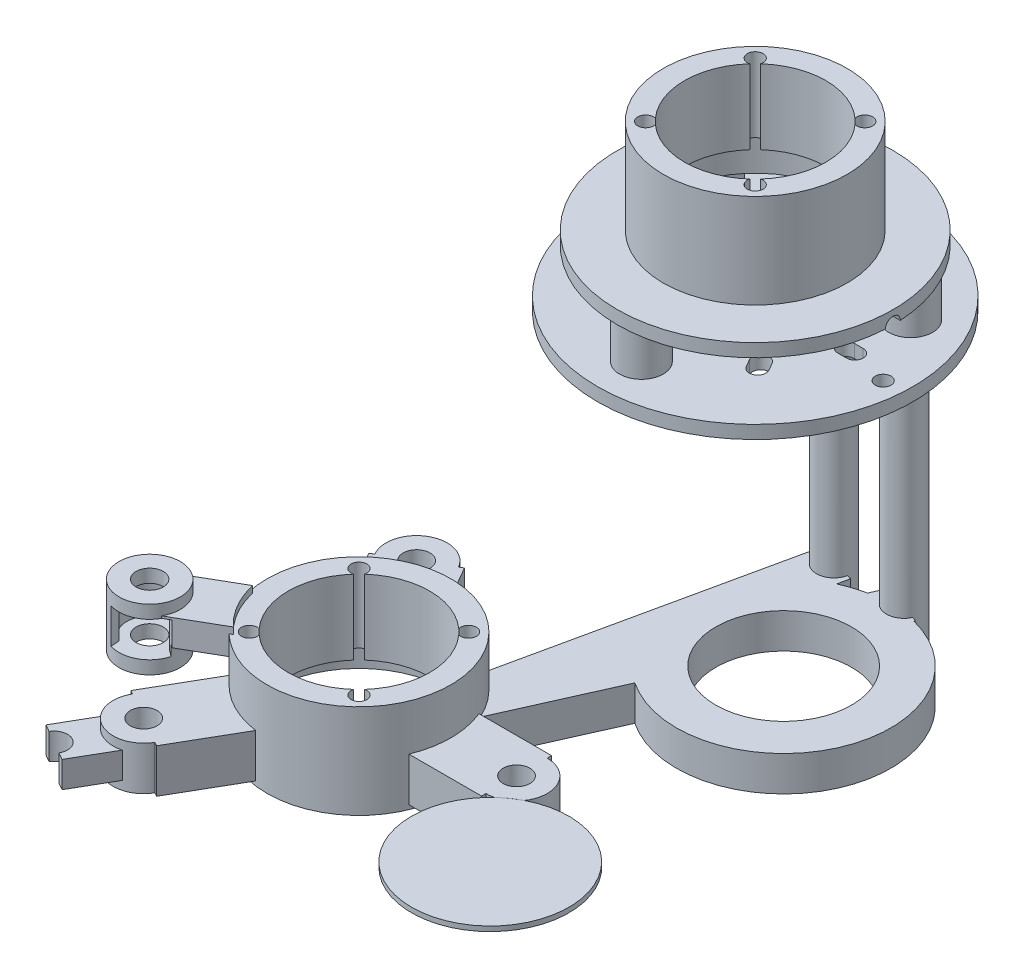
from build123d import *

# Parameters (mm, degrees)
CARRIER_INBOARD_FRAME_SKETCH_R              = 15.5
CARRIER_INBOARD_FRAME_SKETCH_R_2            = 3.050000001
CARRIER_INBOARD_FRAME_SKETCH_R_3            = 3.050000002
CARRIER_INBOARD_FRAME_SKETCH_R_4            = 3.049999999
CARRIER_INBOARD_FRAME_DEPTH                 = 4.5
CARRIER_START                               = 0.9
CARRIER_GUIDE_AND_PIVOT_FRAME_2_SKETCH_R    = 15.5
CARRIER_GUIDE_AND_PIVOT_FRAME_2_SKETCH_R_2  = 3.050000001
CARRIER_GUIDE_AND_PIVOT_FRAME_2_SKETCH_R_3  = 3.050000002
CARRIER_GUIDE_AND_PIVOT_FRAME_2_SKETCH_R_4  = 3.049999999
CARRIER_GUIDE_AND_PIVOT_FRAME_2_DEPTH       = 0.9
CARRIER_START_2                             = 0.1
CARRIER_GUIDE_AND_PIVOT_FRAME_3_SKETCH_R    = 15.5
CARRIER_GUIDE_AND_PIVOT_FRAME_3_SKETCH_R_2  = 3.050000001
CARRIER_GUIDE_AND_PIVOT_FRAME_3_SKETCH_R_3  = 3.050000002
CARRIER_GUIDE_AND_PIVOT_FRAME_3_SKETCH_R_4  = 3.049999999
CARRIER_GUIDE_AND_PIVOT_FRAME_3_DEPTH       = 0.1
CARRIER_START_3                             = 0.999999998
CARRIER_GUIDE_AND_PIVOT_FRAME_4_SKETCH_R    = 4
CARRIER_GUIDE_AND_PIVOT_FRAME_4_SKETCH_R_2  = 3.050000001
CARRIER_GUIDE_AND_PIVOT_FRAME_4_SKETCH_R_3  = 3.050000002
CARRIER_GUIDE_AND_PIVOT_FRAME_4_SKETCH_R_4  = 3.049999999
CARRIER_GUIDE_AND_PIVOT_FRAME_4_DEPTH       = 0.999999998
CARRIER_START_4                             = 0.010000002
CARRIER_GUIDE_AND_PIVOT_FRAME_5_SKETCH_R    = 4
CARRIER_GUIDE_AND_PIVOT_FRAME_5_SKETCH_R_2  = 21
CARRIER_GUIDE_AND_PIVOT_FRAME_5_SKETCH_R_3  = 18.000000001
CARRIER_GUIDE_AND_PIVOT_FRAME_5_DEPTH       = 0.010000002
CARRIER_START_5                             = 0.490000001
CARRIER_GUIDE_AND_PIVOT_FRAME_6_SKETCH_R    = 4
CARRIER_GUIDE_AND_PIVOT_FRAME_6_SKETCH_R_2  = 21
CARRIER_GUIDE_AND_PIVOT_FRAME_6_DEPTH       = 0.490000001
CARRIER_START_6                             = 2.999999998
CARRIER_GUIDE_AND_PIVOT_FRAME_7_SKETCH_R    = 4
CARRIER_GUIDE_AND_PIVOT_FRAME_7_SKETCH_R_2  = 21
CARRIER_GUIDE_AND_PIVOT_FRAME_7_SKETCH_R_3  = 3.1
CARRIER_GUIDE_AND_PIVOT_FRAME_7_DEPTH       = 2.999999998
CARRIER_GUIDE_AND_PIVOT_FRAME_8_SKETCH_R    = 4
CARRIER_GUIDE_AND_PIVOT_FRAME_8_SKETCH_R_2  = 21
CARRIER_GUIDE_AND_PIVOT_FRAME_8_DEPTH       = 2.500000001
CARRIER_GUIDE_AND_PIVOT_FRAME_9_SKETCH_R    = 4
CARRIER_GUIDE_AND_PIVOT_FRAME_9_DEPTH       = 4.5
CARRIER_GUIDE_AND_PIVOT_FRAME_10_SKETCH_R   = 4
CARRIER_GUIDE_AND_PIVOT_FRAME_10_DEPTH      = 1.000000001
CARRIER_GUIDE_AND_PIVOT_FRAME_11_SKETCH_R   = 4
CARRIER_GUIDE_AND_PIVOT_FRAME_11_SKETCH_R_2 = 3.1
CARRIER_GUIDE_AND_PIVOT_FRAME_11_DEPTH      = 0.5
CARRIER_GUIDE_AND_PIVOT_FRAME_12_SKETCH_R   = 4
CARRIER_GUIDE_AND_PIVOT_FRAME_12_SKETCH_R_2 = 3.1
CARRIER_GUIDE_AND_PIVOT_FRAME_12_DEPTH      = 2.499999999
CARRIER_WHEEL_SUPPORT_13_SKETCH_R           = 4
CARRIER_WHEEL_SUPPORT_13_DEPTH              = 43.5
CARRIER_WHEEL_SUPPORT_14_SKETCH_R           = 4
CARRIER_WHEEL_SUPPORT_14_DEPTH              = 2.2
CARRIER_WHEEL_SUPPORT_15_SKETCH_R           = 4
CARRIER_WHEEL_SUPPORT_15_DEPTH              = 2.9
CARRIER_WHEEL_SUPPORT_16_SKETCH_R           = 4
CARRIER_WHEEL_SUPPORT_16_DEPTH              = 2.9
CARRIER_WHEEL_SUPPORT_17_SKETCH_R           = 36
CARRIER_WHEEL_SUPPORT_17_SKETCH_R_2         = 1.8
CARRIER_WHEEL_SUPPORT_17_SKETCH_R_3         = 5
CARRIER_WHEEL_SUPPORT_17_DEPTH              = 3
CARRIER_WHEEL_SUPPORT_18_SKETCH_R           = 5
CARRIER_WHEEL_SUPPORT_18_SKETCH_R_2         = 4
CARRIER_WHEEL_SUPPORT_18_DEPTH              = 0.9
CARRIER_WHEEL_SUPPORT_19_SKETCH_R           = 5
CARRIER_WHEEL_SUPPORT_19_SKETCH_R_2         = 4
CARRIER_WHEEL_SUPPORT_19_DEPTH              = 1.5
CARRIER_WHEEL_SUPPORT_20_SKETCH_R           = 5
CARRIER_WHEEL_SUPPORT_20_SKETCH_R_2         = 4
CARRIER_WHEEL_SUPPORT_20_DEPTH              = 7.600000002
CARRIER_WHEEL_SUPPORT_21_SKETCH_R           = 31.5
CARRIER_WHEEL_SUPPORT_21_SKETCH_R_2         = 20.15
CARRIER_WHEEL_SUPPORT_21_DEPTH              = 2.999999998
CARRIER_WHEEL_SUPPORT_22_SKETCH_R           = 21
CARRIER_WHEEL_SUPPORT_22_SKETCH_R_2         = 20.15
CARRIER_WHEEL_SUPPORT_22_DEPTH              = 4.5
CARRIER_WHEEL_SUPPORT_23_SKETCH_R           = 21
CARRIER_WHEEL_SUPPORT_23_DEPTH              = 17
CARRIER_GUIDE_AND_PIVOT_FRAME_24_SKETCH_R   = 15.500000001
CARRIER_GUIDE_AND_PIVOT_FRAME_24_SKETCH_R_2 = 20.150000001
CARRIER_GUIDE_AND_PIVOT_FRAME_24_SKETCH_R_3 = 3.05
CARRIER_GUIDE_AND_PIVOT_FRAME_24_SKETCH_R_4 = 3.050000003
CARRIER_GUIDE_AND_PIVOT_FRAME_24_DEPTH      = 1.499999999
CARRIER_GUIDE_AND_PIVOT_FRAME_25_SKETCH_R   = 15.500000001
CARRIER_GUIDE_AND_PIVOT_FRAME_25_SKETCH_R_2 = 20.150000001
CARRIER_GUIDE_AND_PIVOT_FRAME_25_SKETCH_R_3 = 3.05
CARRIER_GUIDE_AND_PIVOT_FRAME_25_SKETCH_R_4 = 3.050000003
CARRIER_GUIDE_AND_PIVOT_FRAME_25_DEPTH      = 0.999999996
CARRIER_GUIDE_AND_PIVOT_FRAME_26_SKETCH_R   = 20.150000001
CARRIER_GUIDE_AND_PIVOT_FRAME_26_SKETCH_R_2 = 3.05
CARRIER_GUIDE_AND_PIVOT_FRAME_26_SKETCH_R_3 = 3.050000003
CARRIER_GUIDE_AND_PIVOT_FRAME_26_DEPTH      = 1.000000006
CARRIER_GUIDE_AND_PIVOT_FRAME_27_SKETCH_R   = 21
CARRIER_GUIDE_AND_PIVOT_FRAME_27_SKETCH_R_2 = 20.15
CARRIER_GUIDE_AND_PIVOT_FRAME_27_DEPTH      = 0.999999998
COUPLING_PIN_SERVICE_CHANNEL_SKETCH_R       = 1.7
COUPLING_PIN_SERVICE_CHANNEL_DEPTH          = 66


with BuildPart() as part:
    # Carrier Inboard Frame Sketch → Carrier Inboard Frame (new body)
    with BuildSketch(Plane(origin=(0, 132, 0), x_dir=(1, 0, 0), z_dir=(0, 1, 0))):
        with BuildLine():
            Line((-30.917751515, 80.095230605), (-31.894893673, 80.307817537))
            Line((-31.894893673, 80.307817537), (-45.453402184, 17.987005233))
            ThreePointArc((-45.453402184, 17.987005233), (-52.021603008, 20.561291011), (-59.071691938, 20.81517172))
            Line((-59.071691938, 20.81517172), (-67.363448018, 35.176914535))
            Line((-67.363448018, 35.176914535), (-68.229473421, 34.676914535))
            ThreePointArc((-68.229473421, 34.676914535), (-77.791651247, 37.239092362), (-80.353829074, 27.676914536))
            Line((-80.353829074, 27.676914536), (-81.219854478, 27.176914536))
            Line((-81.219854478, 27.176914536), (-72.928098397, 12.815171719))
            ThreePointArc((-72.928098397, 12.815171719), (-77.291651246, 0), (-72.928098397, -12.815171719))
            Line((-72.928098397, -12.815171719), (-81.219854478, -27.176914536))
            Line((-81.219854478, -27.176914536), (-80.353829072, -27.676914537))
            ThreePointArc((-80.353829072, -27.676914537), (-81.227012981, -30.227832035), (-81.071268007, -32.919555224))
            Line((-81.071268007, -32.919555224), (-86.121778264, -41.667295594))
            Line((-86.121778264, -41.667295594), (-84.476329997, -42.617295594))
            ThreePointArc((-84.476329997, -42.617295594), (-80.241651245, -41.482616842), (-79.106972494, -45.717295594))
            Line((-79.106972494, -45.717295594), (-77.461524226, -46.667295594))
            Line((-77.461524226, -46.667295594), (-72.411013969, -37.919555224))
            ThreePointArc((-72.411013969, -37.919555224), (-70.002040821, -36.708572734), (-68.229473419, -34.676914537))
            Line((-68.229473419, -34.676914537), (-67.363448017, -35.176914536))
            Line((-67.363448017, -35.176914536), (-59.071691937, -20.815171721))
            ThreePointArc((-59.071691937, -20.815171721), (-57.684740236, -20.953741982), (-56.291651246, -21))
            ThreePointArc((-56.291651246, -21), (-44.6083298, -17.449928367), (-36.875163407, -8))
            Line((-36.875163407, -8), (-20.291651246, -8))
            Line((-20.291651246, -8), (-20.291651246, -7))
            ThreePointArc((-20.291651246, -7), (-17.066350873, -6.212683599), (-14.566573894, -4.027839286))
            Line((-14.566573894, -4.027839286), (-14.552272959, -4.007435199))
            ThreePointArc((-14.552272959, -4.007435199), (-14.084717769, 3.236352392), (-20.291651247, 7))
            Line((-20.291651247, 7), (-20.291651247, 8))
            Line((-20.291651247, 8), (-36.875163407, 8))
            ThreePointArc((-36.875163407, 8), (-36.968781126, 8.223544876), (-37.06497245, 8.445994462))
            Line((-37.06497245, 8.445994462), (-26.171286763, 32.907800552))
            ThreePointArc((-26.171286763, 32.907800552), (9.87180094, 43.277859095), (-6.533321658, 77.004914078))
            Line((-6.533321658, 77.004914078), (-6.441635164, 77.210796392))
            Line((-6.441635164, 77.210796392), (-7.355144702, 77.617613686))
            ThreePointArc((-7.355144702, 77.617613686), (-7.1390628, 80.255907409), (-8.617920583, 82.451417558))
            ThreePointArc((-8.617920583, 82.451417558), (-12.020207409, 83.115002954), (-14.663221052, 80.872152065))
            Line((-14.663221052, 80.872152065), (-15.576730603, 81.278969365))
            Line((-15.576730603, 81.278969365), (-17.367224839, 77.258408824))
            ThreePointArc((-17.367224839, 77.258408824), (-20.084271186, 76.544411569), (-22.701719693, 75.524070327))
            Line((-22.701719693, 75.524070327), (-22.123472094, 78.181948221))
            Line((-22.123472094, 78.181948221), (-23.100614252, 78.394535152))
            ThreePointArc((-23.100614252, 78.394535152), (-23.840404568, 81.685957231), (-26.834136801, 83.241050902))
            ThreePointArc((-26.834136801, 83.241050902), (-29.450257235, 82.413661194), (-30.917751515, 80.095230605))
        make_face()
        with Locations((-12.509182883, 53.244882879)):
            Circle(CARRIER_INBOARD_FRAME_SKETCH_R, mode=Mode.SUBTRACT)
        with Locations((-20.291651247, 0)):
            Circle(CARRIER_INBOARD_FRAME_SKETCH_R_2, mode=Mode.SUBTRACT)
        with Locations((-74.291651248, 31.176914536)):
            Circle(CARRIER_INBOARD_FRAME_SKETCH_R_3, mode=Mode.SUBTRACT)
        with Locations((-74.291651245, -31.176914537)):
            Circle(CARRIER_INBOARD_FRAME_SKETCH_R_4, mode=Mode.SUBTRACT)
        with BuildLine():
            ThreePointArc((-67.076797269, -12.020945274), (-70.080233479, -13.788582233), (-68.31259652, -10.785146023))
            ThreePointArc((-68.31259652, -10.785146023), (-72.441651246, 0), (-68.31259652, 10.785146023))
            ThreePointArc((-68.31259652, 10.785146023), (-70.080233479, 13.788582233), (-67.076797269, 12.020945274))
            ThreePointArc((-67.076797269, 12.020945274), (-56.291651246, 16.15), (-45.506505223, 12.020945274))
            ThreePointArc((-45.506505223, 12.020945274), (-42.503069013, 13.788582233), (-44.270705972, 10.785146023))
            ThreePointArc((-44.270705972, 10.785146023), (-40.141651246, 0), (-44.270705972, -10.785146023))
            ThreePointArc((-44.270705972, -10.785146023), (-42.503069013, -13.788582233), (-45.506505223, -12.020945274))
            ThreePointArc((-45.506505223, -12.020945274), (-56.291651246, -16.15), (-67.076797269, -12.020945274))
        make_face(mode=Mode.SUBTRACT)
    extrude(amount=-CARRIER_INBOARD_FRAME_DEPTH)

    # Carrier Guide and Pivot Frame 2 Sketch → Carrier Guide and Pivot Frame 2 (add)
    with BuildSketch(Plane(origin=(0, 132, 0), x_dir=(1, 0, 0), z_dir=(0, 1, 0)).offset(CARRIER_START)):
        with BuildLine():
            Line((-30.917751515, 80.095230605), (-31.894893673, 80.307817537))
            Line((-31.894893673, 80.307817537), (-45.453402184, 17.987005233))
            ThreePointArc((-45.453402184, 17.987005233), (-52.021603008, 20.561291011), (-59.071691938, 20.81517172))
            Line((-59.071691938, 20.81517172), (-67.363448018, 35.176914535))
            Line((-67.363448018, 35.176914535), (-68.229473421, 34.676914536))
            ThreePointArc((-68.229473421, 34.676914536), (-77.791651247, 37.239092362), (-80.353829074, 27.676914536))
            Line((-80.353829074, 27.676914536), (-81.219854478, 27.176914536))
            Line((-81.219854478, 27.176914536), (-72.928098397, 12.815171719))
            ThreePointArc((-72.928098397, 12.815171719), (-77.291651246, 0), (-72.928098397, -12.815171719))
            Line((-72.928098397, -12.815171719), (-81.219854478, -27.176914536))
            Line((-81.219854478, -27.176914536), (-80.353829071, -27.676914537))
            ThreePointArc((-80.353829071, -27.676914537), (-79.823309442, -35.466524962), (-72.411013969, -37.919555224))
            ThreePointArc((-72.411013969, -37.919555224), (-70.002040821, -36.708572734), (-68.229473419, -34.676914537))
            Line((-68.229473419, -34.676914537), (-67.363448017, -35.176914536))
            Line((-67.363448017, -35.176914536), (-59.071691937, -20.815171721))
            ThreePointArc((-59.071691937, -20.815171721), (-57.684740236, -20.953741982), (-56.291651246, -21))
            ThreePointArc((-56.291651246, -21), (-44.6083298, -17.449928367), (-36.875163407, -8))
            Line((-36.875163407, -8), (-20.291651246, -8))
            Line((-20.291651246, -8), (-20.291651246, -7))
            ThreePointArc((-20.291651246, -7), (-17.066350873, -6.212683599), (-14.566573895, -4.027839286))
            Line((-14.566573895, -4.027839286), (-14.55227296, -4.007435199))
            ThreePointArc((-14.55227296, -4.007435199), (-14.084717769, 3.236352392), (-20.291651247, 7))
            Line((-20.291651247, 7), (-20.291651247, 8))
            Line((-20.291651247, 8), (-36.875163407, 8))
            ThreePointArc((-36.875163407, 8), (-36.968781126, 8.223544876), (-37.06497245, 8.445994462))
            Line((-37.06497245, 8.445994462), (-26.171286763, 32.907800552))
            ThreePointArc((-26.171286763, 32.907800552), (9.87180094, 43.277859095), (-6.533321658, 77.004914078))
            Line((-6.533321658, 77.004914078), (-6.441635164, 77.210796392))
            Line((-6.441635164, 77.210796392), (-7.355144702, 77.617613686))
            ThreePointArc((-7.355144702, 77.617613686), (-7.1390628, 80.255907409), (-8.617920583, 82.451417558))
            ThreePointArc((-8.617920583, 82.451417558), (-12.02020741, 83.115002954), (-14.663221052, 80.872152065))
            Line((-14.663221052, 80.872152065), (-15.576730603, 81.278969365))
            Line((-15.576730603, 81.278969365), (-17.367224839, 77.258408824))
            ThreePointArc((-17.367224839, 77.258408824), (-20.084271187, 76.544411569), (-22.701719693, 75.524070327))
            Line((-22.701719693, 75.524070327), (-22.123472094, 78.181948221))
            Line((-22.123472094, 78.181948221), (-23.100614252, 78.394535152))
            ThreePointArc((-23.100614252, 78.394535152), (-23.840404569, 81.685957231), (-26.834136802, 83.241050902))
            ThreePointArc((-26.834136802, 83.241050902), (-29.450257235, 82.413661194), (-30.917751515, 80.095230605))
        make_face()
        with Locations((-12.509182883, 53.244882879)):
            Circle(CARRIER_GUIDE_AND_PIVOT_FRAME_2_SKETCH_R, mode=Mode.SUBTRACT)
        with Locations((-20.291651247, 0)):
            Circle(CARRIER_GUIDE_AND_PIVOT_FRAME_2_SKETCH_R_2, mode=Mode.SUBTRACT)
        with Locations((-74.291651248, 31.176914536)):
            Circle(CARRIER_GUIDE_AND_PIVOT_FRAME_2_SKETCH_R_3, mode=Mode.SUBTRACT)
        with Locations((-74.291651245, -31.176914537)):
            Circle(CARRIER_GUIDE_AND_PIVOT_FRAME_2_SKETCH_R_4, mode=Mode.SUBTRACT)
        with BuildLine():
            ThreePointArc((-67.076797269, -12.020945274), (-70.080233479, -13.788582233), (-68.31259652, -10.785146023))
            ThreePointArc((-68.31259652, -10.785146023), (-72.441651246, 0), (-68.31259652, 10.785146023))
            ThreePointArc((-68.31259652, 10.785146023), (-70.080233479, 13.788582233), (-67.076797269, 12.020945274))
            ThreePointArc((-67.076797269, 12.020945274), (-56.291651246, 16.15), (-45.506505223, 12.020945274))
            ThreePointArc((-45.506505223, 12.020945274), (-42.503069013, 13.788582233), (-44.270705972, 10.785146023))
            ThreePointArc((-44.270705972, 10.785146023), (-40.141651246, 0), (-44.270705972, -10.785146023))
            ThreePointArc((-44.270705972, -10.785146023), (-42.503069013, -13.788582233), (-45.506505223, -12.020945274))
            ThreePointArc((-45.506505223, -12.020945274), (-56.291651246, -16.15), (-67.076797269, -12.020945274))
        make_face(mode=Mode.SUBTRACT)
    extrude(amount=-CARRIER_GUIDE_AND_PIVOT_FRAME_2_DEPTH)

    # Carrier Guide and Pivot Frame 3 Sketch → Carrier Guide and Pivot Frame 3 (add)
    with BuildSketch(Plane(origin=(0, 132.900000001, 0), x_dir=(1, 0, 0), z_dir=(0, 1, 0)).offset(CARRIER_START_2)):
        with BuildLine():
            Line((-30.917751515, 80.095230605), (-31.894893673, 80.307817537))
            Line((-31.894893673, 80.307817537), (-45.453402184, 17.987005233))
            ThreePointArc((-45.453402184, 17.987005233), (-52.021603008, 20.561291011), (-59.071691938, 20.81517172))
            Line((-59.071691938, 20.81517172), (-67.363448018, 35.176914535))
            Line((-67.363448018, 35.176914535), (-68.229473421, 34.676914536))
            ThreePointArc((-68.229473421, 34.676914536), (-77.791651247, 37.239092362), (-80.353829074, 27.676914536))
            Line((-80.353829074, 27.676914536), (-81.219854478, 27.176914536))
            Line((-81.219854478, 27.176914536), (-72.928098397, 12.815171719))
            ThreePointArc((-72.928098397, 12.815171719), (-77.291651246, 0), (-72.928098397, -12.815171719))
            Line((-72.928098397, -12.815171719), (-81.219854478, -27.176914536))
            Line((-81.219854478, -27.176914536), (-80.353829071, -27.676914537))
            ThreePointArc((-80.353829071, -27.676914537), (-79.823309442, -35.466524962), (-72.411013969, -37.919555224))
            ThreePointArc((-72.411013969, -37.919555224), (-70.002040821, -36.708572734), (-68.229473419, -34.676914537))
            Line((-68.229473419, -34.676914537), (-67.363448017, -35.176914536))
            Line((-67.363448017, -35.176914536), (-59.071691937, -20.815171721))
            ThreePointArc((-59.071691937, -20.815171721), (-57.684740236, -20.953741982), (-56.291651246, -21))
            ThreePointArc((-56.291651246, -21), (-44.6083298, -17.449928367), (-36.875163407, -8))
            Line((-36.875163407, -8), (-20.291651246, -8))
            Line((-20.291651246, -8), (-20.291651246, -7))
            ThreePointArc((-20.291651246, -7), (-19.383531808, -6.940844263), (-18.490761077, -6.764376882))
            ThreePointArc((-18.490761077, -6.764376882), (4.030670954, -34.74617457), (-14.55227296, -4.007435199))
            ThreePointArc((-14.55227296, -4.007435199), (-14.084717769, 3.236352392), (-20.291651247, 7))
            Line((-20.291651247, 7), (-20.291651247, 8))
            Line((-20.291651247, 8), (-36.875163407, 8))
            ThreePointArc((-36.875163407, 8), (-36.968781126, 8.223544876), (-37.06497245, 8.445994462))
            Line((-37.06497245, 8.445994462), (-26.171286763, 32.907800552))
            ThreePointArc((-26.171286763, 32.907800552), (9.87180094, 43.277859095), (-6.533321658, 77.004914078))
            Line((-6.533321658, 77.004914078), (-6.441635164, 77.210796392))
            Line((-6.441635164, 77.210796392), (-7.355144702, 77.617613686))
            ThreePointArc((-7.355144702, 77.617613686), (-7.1390628, 80.255907409), (-8.617920583, 82.451417558))
            ThreePointArc((-8.617920583, 82.451417558), (-12.02020741, 83.115002954), (-14.663221053, 80.872152065))
            Line((-14.663221053, 80.872152065), (-15.576730603, 81.278969365))
            Line((-15.576730603, 81.278969365), (-17.367224839, 77.258408824))
            ThreePointArc((-17.367224839, 77.258408824), (-20.084271187, 76.544411569), (-22.701719693, 75.524070327))
            Line((-22.701719693, 75.524070327), (-22.123472094, 78.181948221))
            Line((-22.123472094, 78.181948221), (-23.100614253, 78.394535153))
            ThreePointArc((-23.100614253, 78.394535153), (-23.840404569, 81.685957231), (-26.834136802, 83.241050902))
            ThreePointArc((-26.834136802, 83.241050902), (-29.450257235, 82.413661194), (-30.917751515, 80.095230605))
        make_face()
        with Locations((-12.509182883, 53.244882879)):
            Circle(CARRIER_GUIDE_AND_PIVOT_FRAME_3_SKETCH_R, mode=Mode.SUBTRACT)
        with Locations((-20.291651247, 0)):
            Circle(CARRIER_GUIDE_AND_PIVOT_FRAME_3_SKETCH_R_2, mode=Mode.SUBTRACT)
        with Locations((-74.291651248, 31.176914536)):
            Circle(CARRIER_GUIDE_AND_PIVOT_FRAME_3_SKETCH_R_3, mode=Mode.SUBTRACT)
        with Locations((-74.291651245, -31.176914537)):
            Circle(CARRIER_GUIDE_AND_PIVOT_FRAME_3_SKETCH_R_4, mode=Mode.SUBTRACT)
        with BuildLine():
            ThreePointArc((-67.076797269, -12.020945274), (-70.080233479, -13.788582233), (-68.31259652, -10.785146023))
            ThreePointArc((-68.31259652, -10.785146023), (-72.441651246, 0), (-68.31259652, 10.785146023))
            ThreePointArc((-68.31259652, 10.785146023), (-70.080233479, 13.788582233), (-67.076797269, 12.020945274))
            ThreePointArc((-67.076797269, 12.020945274), (-56.291651246, 16.15), (-45.506505223, 12.020945274))
            ThreePointArc((-45.506505223, 12.020945274), (-42.503069013, 13.788582233), (-44.270705972, 10.785146023))
            ThreePointArc((-44.270705972, 10.785146023), (-40.141651246, 0), (-44.270705972, -10.785146023))
            ThreePointArc((-44.270705972, -10.785146023), (-42.503069013, -13.788582233), (-45.506505223, -12.020945274))
            ThreePointArc((-45.506505223, -12.020945274), (-56.291651246, -16.15), (-67.076797269, -12.020945274))
        make_face(mode=Mode.SUBTRACT)
    extrude(amount=-CARRIER_GUIDE_AND_PIVOT_FRAME_3_DEPTH)

    # Carrier Guide and Pivot Frame 4 Sketch → Carrier Guide and Pivot Frame 4 (add)
    # profile 1 of 3: a face of its own
    with BuildSketch(Plane(origin=(0, 133, 0), x_dir=(1, 0, 0), z_dir=(0, 1, 0)).offset(CARRIER_START_3)):
        with Locations((-27.009182884, 79.244882879)):
            Circle(CARRIER_GUIDE_AND_PIVOT_FRAME_4_SKETCH_R)
    # profile 2 of 3: a face of its own
    with BuildSketch(Plane(origin=(0, 133, 0), x_dir=(1, 0, 0), z_dir=(0, 1, 0)).offset(CARRIER_START_3)):
        with Locations((-11.009182876, 79.244882879)):
            Circle(CARRIER_GUIDE_AND_PIVOT_FRAME_4_SKETCH_R)
    # profile 3 of 3: a face of its own
    with BuildSketch(Plane(origin=(0, 133, 0), x_dir=(1, 0, 0), z_dir=(0, 1, 0)).offset(CARRIER_START_3)):
        with BuildLine():
            Line((-67.363448017, -35.176914536), (-59.071691937, -20.815171721))
            ThreePointArc((-59.071691937, -20.815171721), (-57.684740236, -20.953741982), (-56.291651246, -21))
            ThreePointArc((-56.291651246, -21), (-44.6083298, -17.449928367), (-36.875163407, -8))
            Line((-36.875163407, -8), (-20.291651246, -8))
            Line((-20.291651246, -8), (-20.291651246, -7))
            ThreePointArc((-20.291651246, -7), (-19.383531808, -6.940844263), (-18.490761077, -6.764376882))
            ThreePointArc((-18.490761077, -6.764376882), (4.030670954, -34.74617457), (-14.55227296, -4.007435199))
            ThreePointArc((-14.55227296, -4.007435199), (-14.084717769, 3.236352392), (-20.291651247, 7))
            Line((-20.291651247, 7), (-20.291651247, 8))
            Line((-20.291651247, 8), (-36.875163407, 8))
            ThreePointArc((-36.875163407, 8), (-45.791651247, 18.18653348), (-59.071691938, 20.81517172))
            Line((-59.071691938, 20.81517172), (-67.363448018, 35.176914535))
            Line((-67.363448018, 35.176914535), (-68.229473421, 34.676914536))
            ThreePointArc((-68.229473421, 34.676914536), (-77.791651247, 37.239092362), (-80.353829074, 27.676914536))
            Line((-80.353829074, 27.676914536), (-81.219854478, 27.176914536))
            Line((-81.219854478, 27.176914536), (-72.928098397, 12.815171719))
            ThreePointArc((-72.928098397, 12.815171719), (-77.291651246, 0), (-72.928098397, -12.815171719))
            Line((-72.928098397, -12.815171719), (-81.219854478, -27.176914536))
            Line((-81.219854478, -27.176914536), (-80.353829071, -27.676914537))
            ThreePointArc((-80.353829071, -27.676914537), (-79.823309442, -35.466524962), (-72.411013969, -37.919555224))
            ThreePointArc((-72.411013969, -37.919555224), (-70.002040821, -36.708572734), (-68.229473419, -34.676914537))
            Line((-68.229473419, -34.676914537), (-67.363448017, -35.176914536))
        make_face()
        with Locations((-20.291651247, 0)):
            Circle(CARRIER_GUIDE_AND_PIVOT_FRAME_4_SKETCH_R_2, mode=Mode.SUBTRACT)
        with Locations((-74.291651248, 31.176914536)):
            Circle(CARRIER_GUIDE_AND_PIVOT_FRAME_4_SKETCH_R_3, mode=Mode.SUBTRACT)
        with Locations((-74.291651245, -31.176914537)):
            Circle(CARRIER_GUIDE_AND_PIVOT_FRAME_4_SKETCH_R_4, mode=Mode.SUBTRACT)
        with BuildLine():
            ThreePointArc((-67.076797269, -12.020945274), (-70.080233479, -13.788582233), (-68.31259652, -10.785146023))
            ThreePointArc((-68.31259652, -10.785146023), (-72.441651246, 0), (-68.31259652, 10.785146023))
            ThreePointArc((-68.31259652, 10.785146023), (-70.080233479, 13.788582233), (-67.076797269, 12.020945274))
            ThreePointArc((-67.076797269, 12.020945274), (-56.291651246, 16.15), (-45.506505223, 12.020945274))
            ThreePointArc((-45.506505223, 12.020945274), (-42.503069013, 13.788582233), (-44.270705972, 10.785146023))
            ThreePointArc((-44.270705972, 10.785146023), (-40.141651246, 0), (-44.270705972, -10.785146023))
            ThreePointArc((-44.270705972, -10.785146023), (-42.503069013, -13.788582233), (-45.506505223, -12.020945274))
            ThreePointArc((-45.506505223, -12.020945274), (-56.291651246, -16.15), (-67.076797269, -12.020945274))
        make_face(mode=Mode.SUBTRACT)
    extrude(amount=-CARRIER_GUIDE_AND_PIVOT_FRAME_4_DEPTH)

    # Carrier Guide and Pivot Frame 5 Sketch → Carrier Guide and Pivot Frame 5 (add)
    # profile 1 of 4: a face of its own
    with BuildSketch(Plane(origin=(0, 133.999999999, 0), x_dir=(1, 0, 0), z_dir=(0, 1, 0)).offset(CARRIER_START_4)):
        with Locations((-27.009182884, 79.244882879)):
            Circle(CARRIER_GUIDE_AND_PIVOT_FRAME_5_SKETCH_R)
    # profile 2 of 4: a face of its own
    with BuildSketch(Plane(origin=(0, 133.999999999, 0), x_dir=(1, 0, 0), z_dir=(0, 1, 0)).offset(CARRIER_START_4)):
        with Locations((-11.009182876, 79.244882879)):
            Circle(CARRIER_GUIDE_AND_PIVOT_FRAME_5_SKETCH_R)
    # profile 3 of 4: a face of its own
    with BuildSketch(Plane(origin=(0, 133.999999999, 0), x_dir=(1, 0, 0), z_dir=(0, 1, 0)).offset(CARRIER_START_4)):
        with Locations((-56.291651246, 0)):
            Circle(CARRIER_GUIDE_AND_PIVOT_FRAME_5_SKETCH_R_2)
        with BuildLine():
            ThreePointArc((-67.076797269, -12.020945274), (-70.080233479, -13.788582233), (-68.31259652, -10.785146023))
            ThreePointArc((-68.31259652, -10.785146023), (-72.441651246, 0), (-68.31259652, 10.785146023))
            ThreePointArc((-68.31259652, 10.785146023), (-70.080233479, 13.788582233), (-67.076797269, 12.020945274))
            ThreePointArc((-67.076797269, 12.020945274), (-56.291651246, 16.15), (-45.506505223, 12.020945274))
            ThreePointArc((-45.506505223, 12.020945274), (-42.503069013, 13.788582233), (-44.270705972, 10.785146023))
            ThreePointArc((-44.270705972, 10.785146023), (-40.141651246, 0), (-44.270705972, -10.785146023))
            ThreePointArc((-44.270705972, -10.785146023), (-42.503069013, -13.788582233), (-45.506505223, -12.020945274))
            ThreePointArc((-45.506505223, -12.020945274), (-56.291651246, -16.15), (-67.076797269, -12.020945274))
        make_face(mode=Mode.SUBTRACT)
    # profile 4 of 4: a face of its own
    with BuildSketch(Plane(origin=(0, 133.999999999, 0), x_dir=(1, 0, 0), z_dir=(0, 1, 0)).offset(CARRIER_START_4)):
        with Locations((-6.291651246, -20)):
            Circle(CARRIER_GUIDE_AND_PIVOT_FRAME_5_SKETCH_R_3)
    extrude(amount=-CARRIER_GUIDE_AND_PIVOT_FRAME_5_DEPTH)

    # Carrier Guide and Pivot Frame 6 Sketch → Carrier Guide and Pivot Frame 6 (add)
    # profile 1 of 3: a face of its own
    with BuildSketch(Plane(origin=(0, 134.010000001, 0), x_dir=(1, 0, 0), z_dir=(0, 1, 0)).offset(CARRIER_START_5)):
        with Locations((-27.009182884, 79.244882879)):
            Circle(CARRIER_GUIDE_AND_PIVOT_FRAME_6_SKETCH_R)
    # profile 2 of 3: a face of its own
    with BuildSketch(Plane(origin=(0, 134.010000001, 0), x_dir=(1, 0, 0), z_dir=(0, 1, 0)).offset(CARRIER_START_5)):
        with Locations((-11.009182876, 79.244882879)):
            Circle(CARRIER_GUIDE_AND_PIVOT_FRAME_6_SKETCH_R)
    # profile 3 of 3: a face of its own
    with BuildSketch(Plane(origin=(0, 134.010000001, 0), x_dir=(1, 0, 0), z_dir=(0, 1, 0)).offset(CARRIER_START_5)):
        with Locations((-56.291651246, 0)):
            Circle(CARRIER_GUIDE_AND_PIVOT_FRAME_6_SKETCH_R_2)
        with BuildLine():
            ThreePointArc((-67.076797269, -12.020945274), (-70.080233479, -13.788582233), (-68.31259652, -10.785146023))
            ThreePointArc((-68.31259652, -10.785146023), (-72.441651246, 0), (-68.31259652, 10.785146023))
            ThreePointArc((-68.31259652, 10.785146023), (-70.080233479, 13.788582233), (-67.076797269, 12.020945274))
            ThreePointArc((-67.076797269, 12.020945274), (-56.291651246, 16.15), (-45.506505223, 12.020945274))
            ThreePointArc((-45.506505223, 12.020945274), (-42.503069013, 13.788582233), (-44.270705972, 10.785146023))
            ThreePointArc((-44.270705972, 10.785146023), (-40.141651246, 0), (-44.270705972, -10.785146023))
            ThreePointArc((-44.270705972, -10.785146023), (-42.503069013, -13.788582233), (-45.506505223, -12.020945274))
            ThreePointArc((-45.506505223, -12.020945274), (-56.291651246, -16.15), (-67.076797269, -12.020945274))
        make_face(mode=Mode.SUBTRACT)
    extrude(amount=-CARRIER_GUIDE_AND_PIVOT_FRAME_6_DEPTH)

    # Carrier Guide and Pivot Frame 7 Sketch → Carrier Guide and Pivot Frame 7 (add)
    # profile 1 of 4: a face of its own
    with BuildSketch(Plane(origin=(0, 134.500000002, 0), x_dir=(1, 0, 0), z_dir=(0, 1, 0)).offset(CARRIER_START_6)):
        with Locations((-27.009182884, 79.244882879)):
            Circle(CARRIER_GUIDE_AND_PIVOT_FRAME_7_SKETCH_R)
    # profile 2 of 4: a face of its own
    with BuildSketch(Plane(origin=(0, 134.500000002, 0), x_dir=(1, 0, 0), z_dir=(0, 1, 0)).offset(CARRIER_START_6)):
        with Locations((-11.009182876, 79.244882879)):
            Circle(CARRIER_GUIDE_AND_PIVOT_FRAME_7_SKETCH_R)
    # profile 3 of 4: a face of its own
    with BuildSketch(Plane(origin=(0, 134.500000002, 0), x_dir=(1, 0, 0), z_dir=(0, 1, 0)).offset(CARRIER_START_6)):
        with Locations((-56.291651246, 0)):
            Circle(CARRIER_GUIDE_AND_PIVOT_FRAME_7_SKETCH_R_2)
        with BuildLine():
            ThreePointArc((-67.076797269, -12.020945274), (-70.080233479, -13.788582233), (-68.31259652, -10.785146023))
            ThreePointArc((-68.31259652, -10.785146023), (-72.441651246, 0), (-68.31259652, 10.785146023))
            ThreePointArc((-68.31259652, 10.785146023), (-70.080233479, 13.788582233), (-67.076797269, 12.020945274))
            ThreePointArc((-67.076797269, 12.020945274), (-56.291651246, 16.15), (-45.506505223, 12.020945274))
            ThreePointArc((-45.506505223, 12.020945274), (-42.503069013, 13.788582233), (-44.270705972, 10.785146023))
            ThreePointArc((-44.270705972, 10.785146023), (-40.141651246, 0), (-44.270705972, -10.785146023))
            ThreePointArc((-44.270705972, -10.785146023), (-42.503069013, -13.788582233), (-45.506505223, -12.020945274))
            ThreePointArc((-45.506505223, -12.020945274), (-56.291651246, -16.15), (-67.076797269, -12.020945274))
        make_face(mode=Mode.SUBTRACT)
    # profile 4 of 4: a face of its own
    with BuildSketch(Plane(origin=(0, 134.500000002, 0), x_dir=(1, 0, 0), z_dir=(0, 1, 0)).offset(CARRIER_START_6)):
        with BuildLine():
            ThreePointArc((-80.480041275, -20.893376598), (-92.534816728, -13.784075176), (-80.877463026, -21.527839286))
            ThreePointArc((-80.877463026, -21.527839286), (-80.670264028, -21.215924826), (-80.480041275, -20.893376598))
        make_face()
        with Locations((-86.602540378, -17.500000001)):
            Circle(CARRIER_GUIDE_AND_PIVOT_FRAME_7_SKETCH_R_3, mode=Mode.SUBTRACT)
    extrude(amount=-CARRIER_GUIDE_AND_PIVOT_FRAME_7_DEPTH)


with BuildPart() as carrier_guide_and_pivot_frame_7_piece_1:
    # of the separate pieces the step leaves, piece 1, a body of its own (carrier_guide_and_pivot_frame_7_pieces)
    add(part.part.solids().sort_by_distance((-7.355144702, 132, -77.617613686))[0])

    # Carrier Guide and Pivot Frame 8 Sketch → Carrier Guide and Pivot Frame 8 (add)
    # profile 1 of 4: a face of its own
    with BuildSketch(Plane(origin=(0, 137.5, 0), x_dir=(1, 0, 0), z_dir=(0, 1, 0))):
        with Locations((-27.009182884, 79.244882879)):
            Circle(CARRIER_GUIDE_AND_PIVOT_FRAME_8_SKETCH_R)
    # profile 2 of 4: a face of its own
    with BuildSketch(Plane(origin=(0, 137.5, 0), x_dir=(1, 0, 0), z_dir=(0, 1, 0))):
        with Locations((-11.009182876, 79.244882879)):
            Circle(CARRIER_GUIDE_AND_PIVOT_FRAME_8_SKETCH_R)
    # profile 3 of 4: a face of its own
    with BuildSketch(Plane(origin=(0, 137.5, 0), x_dir=(1, 0, 0), z_dir=(0, 1, 0))):
        with Locations((-56.291651246, 0)):
            Circle(CARRIER_GUIDE_AND_PIVOT_FRAME_8_SKETCH_R_2)
        with BuildLine():
            ThreePointArc((-67.076797269, -12.020945274), (-70.080233479, -13.788582233), (-68.31259652, -10.785146023))
            ThreePointArc((-68.31259652, -10.785146023), (-72.441651246, 0), (-68.31259652, 10.785146023))
            ThreePointArc((-68.31259652, 10.785146023), (-70.080233479, 13.788582233), (-67.076797269, 12.020945274))
            ThreePointArc((-67.076797269, 12.020945274), (-56.291651246, 16.15), (-45.506505223, 12.020945274))
            ThreePointArc((-45.506505223, 12.020945274), (-42.503069013, 13.788582233), (-44.270705972, 10.785146023))
            ThreePointArc((-44.270705972, 10.785146023), (-40.141651246, 0), (-44.270705972, -10.785146023))
            ThreePointArc((-44.270705972, -10.785146023), (-42.503069013, -13.788582233), (-45.506505223, -12.020945274))
            ThreePointArc((-45.506505223, -12.020945274), (-56.291651246, -16.15), (-67.076797269, -12.020945274))
        make_face(mode=Mode.SUBTRACT)
    # profile 4 of 4: a face of its own
    with BuildSketch(Plane(origin=(0, 137.5, 0), x_dir=(1, 0, 0), z_dir=(0, 1, 0))):
        with BuildLine():
            Line((-81.398299852, -18.191650588), (-79.855563295, -19.365020168))
            ThreePointArc((-79.855563295, -19.365020168), (-89.936771721, -11.34509128), (-88.725821636, -24.170208145))
            Line((-88.725821636, -24.170208145), (-88.86596326, -22.237026162))
            ThreePointArc((-88.86596326, -22.237026162), (-89.103213886, -12.88381846), (-81.398299852, -18.191650588))
        make_face()
    extrude(amount=CARRIER_GUIDE_AND_PIVOT_FRAME_8_DEPTH)


with BuildPart() as carrier_guide_and_pivot_frame_7_piece_2:
    # of the separate pieces the step leaves, piece 2, a body of its own (carrier_guide_and_pivot_frame_7_pieces)
    add(part.part.solids().sort_by_distance((-80.877463026, 137.5, 21.527839286))[0])


with BuildPart() as carrier_guide_and_pivot_frame_8_piece_1:
    # of the separate pieces the step leaves, piece 1, a body of its own (carrier_guide_and_pivot_frame_8_pieces)
    add(carrier_guide_and_pivot_frame_7_piece_1.part.solids().sort_by_distance((-7.355144702, 132, -77.617613686))[0])

    # Carrier Guide and Pivot Frame 9 Sketch → Carrier Guide and Pivot Frame 9 (add)
    # profile 1 of 3: a face of its own
    with BuildSketch(Plane(origin=(0, 140, 0), x_dir=(1, 0, 0), z_dir=(0, 1, 0))):
        with Locations((-27.009182885, 79.244882879)):
            Circle(CARRIER_GUIDE_AND_PIVOT_FRAME_9_SKETCH_R)
    # profile 2 of 3: a face of its own
    with BuildSketch(Plane(origin=(0, 140, 0), x_dir=(1, 0, 0), z_dir=(0, 1, 0))):
        with Locations((-11.009182877, 79.244882879)):
            Circle(CARRIER_GUIDE_AND_PIVOT_FRAME_9_SKETCH_R)
    # profile 3 of 3: a face of its own
    with BuildSketch(Plane(origin=(0, 140, 0), x_dir=(1, 0, 0), z_dir=(0, 1, 0))):
        with BuildLine():
            Line((-78.982709995, -20.028892107), (-70.720076304, -15.258458321))
            ThreePointArc((-70.720076304, -15.258458321), (-64.056069295, -19.511888999), (-56.291651249, -20.999999997))
            ThreePointArc((-56.291651249, -20.999999997), (-43.276068719, 16.480127776), (-76.720076308, -4.866153466))
            Line((-76.720076308, -4.866153466), (-86.480041404, -10.501071941))
            ThreePointArc((-86.480041404, -10.501071941), (-93.509935226, -16.365144764), (-88.725821637, -24.170208145))
            Line((-88.725821637, -24.170208145), (-88.86596326, -22.237026162))
            ThreePointArc((-88.86596326, -22.237026162), (-89.103213886, -12.883818462), (-81.398299852, -18.191650588))
            Line((-81.398299852, -18.191650588), (-78.982709995, -20.028892107))
        make_face()
        with BuildLine():
            ThreePointArc((-67.076797271, -12.020945271), (-70.080233482, -13.78858223), (-68.312596522, -10.78514602))
            ThreePointArc((-68.312596522, -10.78514602), (-72.441651249, 3e-09), (-68.312596522, 10.785146025))
            ThreePointArc((-68.312596522, 10.785146025), (-70.080233482, 13.788582236), (-67.076797271, 12.020945276))
            ThreePointArc((-67.076797271, 12.020945276), (-56.291651249, 16.150000003), (-45.506505226, 12.020945276))
            ThreePointArc((-45.506505226, 12.020945276), (-42.503069016, 13.788582236), (-44.270705975, 10.785146025))
            ThreePointArc((-44.270705975, 10.785146025), (-40.141651249, 3e-09), (-44.270705975, -10.78514602))
            ThreePointArc((-44.270705975, -10.78514602), (-42.503069016, -13.78858223), (-45.506505226, -12.020945271))
            ThreePointArc((-45.506505226, -12.020945271), (-56.291651249, -16.149999997), (-67.076797271, -12.020945271))
        make_face(mode=Mode.SUBTRACT)
    extrude(amount=CARRIER_GUIDE_AND_PIVOT_FRAME_9_DEPTH)

    # Carrier Guide and Pivot Frame 10 Sketch → Carrier Guide and Pivot Frame 10 (add)
    with BuildSketch(Plane(origin=(0, 144.5, 0), x_dir=(1, 0, 0), z_dir=(0, 1, 0))):
        with Locations((-27.009182885, 79.244882879)):
            Circle(CARRIER_GUIDE_AND_PIVOT_FRAME_10_SKETCH_R)
        with Locations((-11.009182877, 79.244882879)):
            Circle(CARRIER_GUIDE_AND_PIVOT_FRAME_10_SKETCH_R)
        with BuildLine():
            Line((-78.982709996, -20.028892107), (-70.086516533, -14.892672416))
            ThreePointArc((-70.086516533, -14.892672416), (-73.871966947, -10.149999995), (-76.086516537, -4.500367561))
            Line((-76.086516537, -4.500367561), (-86.480041404, -10.501071941))
            ThreePointArc((-86.480041404, -10.501071941), (-93.509935226, -16.365144764), (-88.725821637, -24.170208145))
            Line((-88.725821637, -24.170208145), (-88.86596326, -22.237026162))
            ThreePointArc((-88.86596326, -22.237026162), (-89.103213886, -12.883818462), (-81.398299852, -18.191650588))
            Line((-81.398299852, -18.191650588), (-78.982709996, -20.028892107))
        make_face()
    extrude(amount=CARRIER_GUIDE_AND_PIVOT_FRAME_10_DEPTH)

    # Carrier Guide and Pivot Frame 11 Sketch → Carrier Guide and Pivot Frame 11 (add)
    # profile 1 of 3: a face of its own
    with BuildSketch(Plane(origin=(0, 145.500000001, 0), x_dir=(1, 0, 0), z_dir=(0, 1, 0))):
        with Locations((-27.009182885, 79.244882879)):
            Circle(CARRIER_GUIDE_AND_PIVOT_FRAME_11_SKETCH_R)
    # profile 2 of 3: a face of its own
    with BuildSketch(Plane(origin=(0, 145.500000001, 0), x_dir=(1, 0, 0), z_dir=(0, 1, 0))):
        with Locations((-11.009182877, 79.244882879)):
            Circle(CARRIER_GUIDE_AND_PIVOT_FRAME_11_SKETCH_R)
    # profile 3 of 3: a face of its own
    with BuildSketch(Plane(origin=(0, 145.500000001, 0), x_dir=(1, 0, 0), z_dir=(0, 1, 0))):
        with BuildLine():
            Line((-80.480041379, -20.893376784), (-70.086516533, -14.892672417))
            ThreePointArc((-70.086516533, -14.892672417), (-73.871966947, -10.149999996), (-76.086516538, -4.500367562))
            Line((-76.086516538, -4.500367562), (-86.480041403, -10.501071941))
            ThreePointArc((-86.480041403, -10.501071941), (-92.843208353, -20.670814289), (-80.877463026, -21.527839286))
            ThreePointArc((-80.877463026, -21.527839286), (-80.670264085, -21.215924916), (-80.480041379, -20.893376784))
        make_face()
        with Locations((-86.602540379, -17.500000001)):
            Circle(CARRIER_GUIDE_AND_PIVOT_FRAME_11_SKETCH_R_2, mode=Mode.SUBTRACT)
    extrude(amount=CARRIER_GUIDE_AND_PIVOT_FRAME_11_DEPTH)

    # Carrier Guide and Pivot Frame 12 Sketch → Carrier Guide and Pivot Frame 12 (add)
    # profile 1 of 3: a face of its own
    with BuildSketch(Plane(origin=(0, 146.000000001, 0), x_dir=(1, 0, 0), z_dir=(0, 1, 0))):
        with Locations((-27.009182885, 79.244882879)):
            Circle(CARRIER_GUIDE_AND_PIVOT_FRAME_12_SKETCH_R)
    # profile 2 of 3: a face of its own
    with BuildSketch(Plane(origin=(0, 146.000000001, 0), x_dir=(1, 0, 0), z_dir=(0, 1, 0))):
        with Locations((-11.009182877, 79.244882879)):
            Circle(CARRIER_GUIDE_AND_PIVOT_FRAME_12_SKETCH_R)
    # profile 3 of 3: a face of its own
    with BuildSketch(Plane(origin=(0, 146.000000001, 0), x_dir=(1, 0, 0), z_dir=(0, 1, 0))):
        with BuildLine():
            ThreePointArc((-80.877463027, -21.527839286), (-80.670264029, -21.215924826), (-80.480041276, -20.893376598))
            ThreePointArc((-80.480041276, -20.893376598), (-92.534816729, -13.784075177), (-80.877463027, -21.527839286))
        make_face()
        with Locations((-86.602540379, -17.500000001)):
            Circle(CARRIER_GUIDE_AND_PIVOT_FRAME_12_SKETCH_R_2, mode=Mode.SUBTRACT)
    extrude(amount=CARRIER_GUIDE_AND_PIVOT_FRAME_12_DEPTH)

    # Carrier Wheel Support 13 Sketch → Carrier Wheel Support 13 (add)
    with BuildSketch(Plane(origin=(0, 148.5, 0), x_dir=(1, 0, 0), z_dir=(0, 1, 0))):
        with Locations((-27.009182887, 79.244882879)):
            Circle(CARRIER_WHEEL_SUPPORT_13_SKETCH_R)
        with Locations((-11.009182879, 79.244882879)):
            Circle(CARRIER_WHEEL_SUPPORT_13_SKETCH_R)
    extrude(amount=CARRIER_WHEEL_SUPPORT_13_DEPTH)

    # Carrier Wheel Support 14 Sketch → Carrier Wheel Support 14 (add)
    with BuildSketch(Plane(origin=(0, 192, 0), x_dir=(1, 0, 0), z_dir=(0, 1, 0))):
        with Locations((-11.009182881, 79.244882879)):
            Circle(CARRIER_WHEEL_SUPPORT_14_SKETCH_R)
        with BuildLine():
            ThreePointArc((-26.834136807, 83.241050902), (-30.875127331, 78.218007242), (-24.874188954, 75.862309761))
            ThreePointArc((-24.874188954, 75.862309761), (-24.446483989, 77.067928358), (-23.325892624, 77.684955694))
            ThreePointArc((-23.325892624, 77.684955694), (-23.626988582, 81.380476863), (-26.834136807, 83.241050902))
        make_face()
    extrude(amount=CARRIER_WHEEL_SUPPORT_14_DEPTH)

    # Carrier Wheel Support 15 Sketch → Carrier Wheel Support 15 (add)
    with BuildSketch(Plane(origin=(0, 194.2, 0), x_dir=(1, 0, 0), z_dir=(0, 1, 0))):
        with Locations((-11.009182882, 79.244882879)):
            Circle(CARRIER_WHEEL_SUPPORT_15_SKETCH_R)
        with BuildLine():
            Line((-26.374639427, 75.902577555), (-26.060772664, 75.358944376))
            ThreePointArc((-26.060772664, 75.358944376), (-30.99006713, 78.854292733), (-26.834136808, 83.241050901))
            ThreePointArc((-26.834136808, 83.241050901), (-23.95706392, 81.830336378), (-23.038624261, 78.760461387))
            Line((-23.038624261, 78.760461387), (-24.724639427, 78.760461387))
            Line((-24.724639427, 78.760461387), (-26.374639427, 75.902577555))
        make_face()
    extrude(amount=CARRIER_WHEEL_SUPPORT_15_DEPTH)

    # Carrier Wheel Support 16 Sketch → Carrier Wheel Support 16 (add)
    with BuildSketch(Plane(origin=(0, 197.1, 0), x_dir=(1, 0, 0), z_dir=(0, 1, 0))):
        with Locations((-11.009182882, 79.244882879)):
            Circle(CARRIER_WHEEL_SUPPORT_16_SKETCH_R)
        with BuildLine():
            ThreePointArc((-26.834136808, 83.241050902), (-30.875127331, 78.218007242), (-24.874188954, 75.862309761))
            ThreePointArc((-24.874188954, 75.862309761), (-24.446483989, 77.067928358), (-23.325892625, 77.684955694))
            ThreePointArc((-23.325892625, 77.684955694), (-23.626988582, 81.380476863), (-26.834136808, 83.241050902))
        make_face()
    extrude(amount=CARRIER_WHEEL_SUPPORT_16_DEPTH)

    # Carrier Wheel Support 17 Sketch → Carrier Wheel Support 17 (add)
    with BuildSketch(Plane(origin=(0, 200, 0), x_dir=(1, 0, 0), z_dir=(0, 1, 0))):
        with Locations((-19.009182883, 53.244882879)):
            Circle(CARRIER_WHEEL_SUPPORT_17_SKETCH_R)
        with Locations((-23.074639427, 75.902577555)):
            Circle(CARRIER_WHEEL_SUPPORT_17_SKETCH_R_2, mode=Mode.SUBTRACT)
        with Locations((-26.848593792, 32.766081772)):
            Circle(CARRIER_WHEEL_SUPPORT_17_SKETCH_R_2, mode=Mode.SUBTRACT)
        with Locations((-19.009182883, 53.244882879)):
            Circle(CARRIER_WHEEL_SUPPORT_17_SKETCH_R_3, mode=Mode.SUBTRACT)
        with Locations((12.395684569, 51.06598931)):
            Circle(CARRIER_WHEEL_SUPPORT_17_SKETCH_R_2, mode=Mode.SUBTRACT)
        with BuildLine():
            Line((-22.28713115, 66.380786071), (-21.28713115, 64.648735264))
            ThreePointArc((-21.28713115, 64.648735264), (-18.691682883, 63.953286997), (-17.996234616, 66.548735264))
            Line((-17.996234616, 66.548735264), (-18.996234616, 68.280786071))
            ThreePointArc((-18.996234616, 68.280786071), (-21.591682883, 68.976234339), (-22.28713115, 66.380786071))
        make_face(mode=Mode.SUBTRACT)
        with BuildLine():
            Line((-28.774182883, 51.344882879), (-26.774182883, 51.344882879))
            ThreePointArc((-26.774182883, 51.344882879), (-24.874182883, 53.244882879), (-26.774182883, 55.144882879))
            Line((-26.774182883, 55.144882879), (-28.774182883, 55.144882879))
            ThreePointArc((-28.774182883, 55.144882879), (-30.674182883, 53.244882879), (-28.774182883, 51.344882879))
        make_face(mode=Mode.SUBTRACT)
        with BuildLine():
            Line((-18.996234616, 38.208979686), (-17.996234616, 39.941030494))
            ThreePointArc((-17.996234616, 39.941030494), (-18.691682883, 42.536478761), (-21.28713115, 41.841030494))
            Line((-21.28713115, 41.841030494), (-22.28713115, 40.108979686))
            ThreePointArc((-22.28713115, 40.108979686), (-21.591682883, 37.513531419), (-18.996234616, 38.208979686))
        make_face(mode=Mode.SUBTRACT)
        with BuildLine():
            Line((-6.02213115, 68.280786071), (-7.02213115, 66.548735264))
            ThreePointArc((-7.02213115, 66.548735264), (-6.326682883, 63.953286997), (-3.731234616, 64.648735264))
            Line((-3.731234616, 64.648735264), (-2.731234616, 66.380786071))
            ThreePointArc((-2.731234616, 66.380786071), (-3.426682883, 68.976234339), (-6.02213115, 68.280786071))
        make_face(mode=Mode.SUBTRACT)
        with BuildLine():
            Line((3.755817117, 55.144882879), (1.755817117, 55.144882879))
            ThreePointArc((1.755817117, 55.144882879), (-0.144182883, 53.244882879), (1.755817117, 51.344882879))
            Line((1.755817117, 51.344882879), (3.755817117, 51.344882879))
            ThreePointArc((3.755817117, 51.344882879), (5.655817117, 53.244882879), (3.755817117, 55.144882879))
        make_face(mode=Mode.SUBTRACT)
        with BuildLine():
            Line((-2.731234616, 40.108979686), (-3.731234616, 41.841030494))
            ThreePointArc((-3.731234616, 41.841030494), (-6.326682883, 42.536478761), (-7.02213115, 39.941030494))
            Line((-7.02213115, 39.941030494), (-6.02213115, 38.208979686))
            ThreePointArc((-6.02213115, 38.208979686), (-3.426682883, 37.513531419), (-2.731234616, 40.108979686))
        make_face(mode=Mode.SUBTRACT)
    extrude(amount=CARRIER_WHEEL_SUPPORT_17_DEPTH)

    # Carrier Wheel Support 18 Sketch → Carrier Wheel Support 18 (add)
    with BuildSketch(Plane(origin=(0, 203, 0), x_dir=(1, 0, 0), z_dir=(0, 1, 0))):
        with Locations((-41.525843382, 66.244882879)):
            Circle(CARRIER_WHEEL_SUPPORT_18_SKETCH_R)
        with Locations((-19.009182883, 27.244882879)):
            Circle(CARRIER_WHEEL_SUPPORT_18_SKETCH_R)
        with Locations((-11.009182882, 79.244882879)):
            Circle(CARRIER_WHEEL_SUPPORT_18_SKETCH_R_2)
        with BuildLine():
            ThreePointArc((-26.22174457, 75.323156104), (-25.513474205, 77.974312316), (-23.011737101, 79.10195926))
            ThreePointArc((-23.011737101, 79.10195926), (-24.070570631, 81.958654791), (-26.834136808, 83.241050902))
            ThreePointArc((-26.834136808, 83.241050902), (-30.997272478, 78.936432821), (-26.22174457, 75.323156104))
        make_face()
        with BuildLine():
            ThreePointArc((3.507477615, 61.244882879), (0.350838555, 62.367302468), (-1.388571099, 65.230630942))
            ThreePointArc((-1.388571099, 65.230630942), (-1.177954603, 66.367760116), (-1.328679291, 67.514365599))
            ThreePointArc((-1.328679291, 67.514365599), (7.466480874, 69.298780912), (3.507477615, 61.244882879))
        make_face()
    extrude(amount=CARRIER_WHEEL_SUPPORT_18_DEPTH)

    # Carrier Wheel Support 19 Sketch → Carrier Wheel Support 19 (add)
    with BuildSketch(Plane(origin=(0, 203.9, 0), x_dir=(1, 0, 0), z_dir=(0, 1, 0))):
        with Locations((-41.525843382, 66.244882879)):
            Circle(CARRIER_WHEEL_SUPPORT_19_SKETCH_R)
        with Locations((-19.009182883, 27.244882879)):
            Circle(CARRIER_WHEEL_SUPPORT_19_SKETCH_R)
        with Locations((-11.009182882, 79.244882879)):
            Circle(CARRIER_WHEEL_SUPPORT_19_SKETCH_R_2)
        with Locations((3.507477615, 66.244882879)):
            Circle(CARRIER_WHEEL_SUPPORT_19_SKETCH_R)
        with BuildLine():
            ThreePointArc((-26.22174457, 75.323156104), (-25.513474205, 77.974312316), (-23.011737101, 79.10195926))
            ThreePointArc((-23.011737101, 79.10195926), (-24.070570631, 81.958654791), (-26.834136808, 83.241050902))
            ThreePointArc((-26.834136808, 83.241050902), (-30.997272478, 78.936432821), (-26.22174457, 75.323156104))
        make_face()
    extrude(amount=CARRIER_WHEEL_SUPPORT_19_DEPTH)

    # Carrier Wheel Support 20 Sketch → Carrier Wheel Support 20 (add)
    with BuildSketch(Plane(origin=(0, 205.4, 0), x_dir=(1, 0, 0), z_dir=(0, 1, 0))):
        with Locations((-41.525843382, 66.244882879)):
            Circle(CARRIER_WHEEL_SUPPORT_20_SKETCH_R)
        with Locations((-27.009182891, 79.244882879)):
            Circle(CARRIER_WHEEL_SUPPORT_20_SKETCH_R_2)
        with Locations((-19.009182883, 27.244882879)):
            Circle(CARRIER_WHEEL_SUPPORT_20_SKETCH_R)
        with Locations((-11.009182883, 79.244882879)):
            Circle(CARRIER_WHEEL_SUPPORT_20_SKETCH_R_2)
        with Locations((3.507477615, 66.244882879)):
            Circle(CARRIER_WHEEL_SUPPORT_20_SKETCH_R)
    extrude(amount=CARRIER_WHEEL_SUPPORT_20_DEPTH)

    # Carrier Wheel Support 21 Sketch → Carrier Wheel Support 21 (add)
    with BuildSketch(Plane(origin=(0, 213.000000002, 0), x_dir=(1, 0, 0), z_dir=(0, 1, 0))):
        with Locations((-19.009182883, 53.244882879)):
            Circle(CARRIER_WHEEL_SUPPORT_21_SKETCH_R)
        with Locations((-19.009182883, 53.244882879)):
            Circle(CARRIER_WHEEL_SUPPORT_21_SKETCH_R_2, mode=Mode.SUBTRACT)
    extrude(amount=CARRIER_WHEEL_SUPPORT_21_DEPTH)

    # Carrier Wheel Support 22 Sketch → Carrier Wheel Support 22 (add)
    with BuildSketch(Plane(origin=(0, 216, 0), x_dir=(1, 0, 0), z_dir=(0, 1, 0))):
        with Locations((-19.009182883, 53.244882879)):
            Circle(CARRIER_WHEEL_SUPPORT_22_SKETCH_R)
        with Locations((-19.009182883, 53.244882879)):
            Circle(CARRIER_WHEEL_SUPPORT_22_SKETCH_R_2, mode=Mode.SUBTRACT)
    extrude(amount=CARRIER_WHEEL_SUPPORT_22_DEPTH)

    # Carrier Wheel Support 23 Sketch → Carrier Wheel Support 23 (add)
    with BuildSketch(Plane(origin=(0, 220.5, 0), x_dir=(1, 0, 0), z_dir=(0, 1, 0))):
        with Locations((-19.009182883, 53.244882879)):
            Circle(CARRIER_WHEEL_SUPPORT_23_SKETCH_R)
        with BuildLine():
            ThreePointArc((-31.030128157, 42.459736856), (-35.159182883, 53.244882879), (-31.030128157, 64.030028901))
            ThreePointArc((-31.030128157, 64.030028901), (-32.797765116, 67.033465112), (-29.794328906, 65.265828152))
            ThreePointArc((-29.794328906, 65.265828152), (-19.009182883, 69.394882879), (-8.224036861, 65.265828152))
            ThreePointArc((-8.224036861, 65.265828152), (-5.22060065, 67.033465112), (-6.98823761, 64.030028901))
            ThreePointArc((-6.98823761, 64.030028901), (-2.859182883, 53.244882879), (-6.98823761, 42.459736856))
            ThreePointArc((-6.98823761, 42.459736856), (-5.22060065, 39.456300646), (-8.224036861, 41.223937605))
            ThreePointArc((-8.224036861, 41.223937605), (-19.009182883, 37.094882879), (-29.794328906, 41.223937605))
            ThreePointArc((-29.794328906, 41.223937605), (-32.797765116, 39.456300646), (-31.030128157, 42.459736856))
        make_face(mode=Mode.SUBTRACT)
    extrude(amount=CARRIER_WHEEL_SUPPORT_23_DEPTH)

    # Carrier Guide and Pivot Frame 24 Sketch → Carrier Guide and Pivot Frame 24 (add)
    with BuildSketch(Plane(origin=(0, 127.5, 0), x_dir=(1, 0, 0), z_dir=(0, 1, 0))):
        with BuildLine():
            Line((-30.917751515, 80.095230606), (-31.894893674, 80.307817538))
            Line((-31.894893674, 80.307817538), (-45.453402184, 17.987005234))
            ThreePointArc((-45.453402184, 17.987005234), (-52.021603009, 20.561291012), (-59.071691938, 20.815171721))
            Line((-59.071691938, 20.815171721), (-67.363448019, 35.176914536))
            Line((-67.363448019, 35.176914536), (-68.229473422, 34.676914536))
            ThreePointArc((-68.229473422, 34.676914536), (-77.791651248, 37.239092362), (-80.353829075, 27.676914536))
            Line((-80.353829075, 27.676914536), (-81.219854479, 27.176914536))
            Line((-81.219854479, 27.176914536), (-72.928098398, 12.81517172))
            ThreePointArc((-72.928098398, 12.81517172), (-77.291651247, 1e-09), (-72.928098398, -12.815171719))
            Line((-72.928098398, -12.815171719), (-81.219854479, -27.176914535))
            Line((-81.219854479, -27.176914535), (-80.353829073, -27.676914536))
            ThreePointArc((-80.353829073, -27.676914536), (-81.227012982, -30.227832035), (-81.071268008, -32.919555223))
            Line((-81.071268008, -32.919555223), (-86.121778265, -41.667295593))
            Line((-86.121778265, -41.667295593), (-84.476329998, -42.617295593))
            ThreePointArc((-84.476329998, -42.617295593), (-80.241651246, -41.482616841), (-79.106972495, -45.717295593))
            Line((-79.106972495, -45.717295593), (-77.461524227, -46.667295593))
            Line((-77.461524227, -46.667295593), (-72.41101397, -37.919555223))
            ThreePointArc((-72.41101397, -37.919555223), (-70.002040822, -36.708572733), (-68.22947342, -34.676914536))
            Line((-68.22947342, -34.676914536), (-67.363448018, -35.176914535))
            Line((-67.363448018, -35.176914535), (-59.071691938, -20.81517172))
            ThreePointArc((-59.071691938, -20.81517172), (-57.684740237, -20.953741982), (-56.291651247, -20.999999999))
            ThreePointArc((-56.291651247, -20.999999999), (-44.608329801, -17.449928366), (-36.875163408, -7.999999999))
            Line((-36.875163408, -7.999999999), (-20.291651247, -7.999999999))
            Line((-20.291651247, -7.999999999), (-20.291651247, -7))
            ThreePointArc((-20.291651247, -7), (-17.066350873, -6.212683599), (-14.566573894, -4.027839286))
            Line((-14.566573894, -4.027839286), (-14.552272959, -4.007435199))
            ThreePointArc((-14.552272959, -4.007435199), (-14.084717768, 3.236352392), (-20.291651246, 7))
            Line((-20.291651246, 7), (-20.291651246, 8.000000001))
            Line((-20.291651246, 8.000000001), (-36.875163408, 8.000000001))
            ThreePointArc((-36.875163408, 8.000000001), (-36.968781127, 8.223544877), (-37.06497245, 8.445994463))
            Line((-37.06497245, 8.445994463), (-26.171286763, 32.907800553))
            ThreePointArc((-26.171286763, 32.907800553), (9.871800939, 43.277859095), (-6.533321658, 77.004914079))
            Line((-6.533321658, 77.004914079), (-6.441635165, 77.210796393))
            Line((-6.441635165, 77.210796393), (-7.355144702, 77.617613687))
            ThreePointArc((-7.355144702, 77.617613687), (-7.139062801, 80.25590741), (-8.617920584, 82.451417559))
            ThreePointArc((-8.617920584, 82.451417559), (-12.02020741, 83.115002954), (-14.663221053, 80.872152066))
            Line((-14.663221053, 80.872152066), (-15.576730604, 81.278969366))
            Line((-15.576730604, 81.278969366), (-17.367224839, 77.258408825))
            ThreePointArc((-17.367224839, 77.258408825), (-20.084271187, 76.54441157), (-22.701719694, 75.524070328))
            Line((-22.701719694, 75.524070328), (-22.123472095, 78.181948221))
            Line((-22.123472095, 78.181948221), (-23.100614253, 78.394535153))
            ThreePointArc((-23.100614253, 78.394535153), (-23.840404569, 81.685957231), (-26.834136802, 83.241050903))
            ThreePointArc((-26.834136802, 83.241050903), (-29.450257236, 82.413661194), (-30.917751515, 80.095230606))
        make_face()
        with Locations((-12.509182884, 53.24488288)):
            Circle(CARRIER_GUIDE_AND_PIVOT_FRAME_24_SKETCH_R, mode=Mode.SUBTRACT)
        with Locations((-56.291651247, 1e-09)):
            Circle(CARRIER_GUIDE_AND_PIVOT_FRAME_24_SKETCH_R_2, mode=Mode.SUBTRACT)
        with Locations((-20.291651246, 0)):
            Circle(CARRIER_GUIDE_AND_PIVOT_FRAME_24_SKETCH_R_3, mode=Mode.SUBTRACT)
        with Locations((-74.291651249, 31.176914536)):
            Circle(CARRIER_GUIDE_AND_PIVOT_FRAME_24_SKETCH_R_4, mode=Mode.SUBTRACT)
        with Locations((-74.291651246, -31.176914536)):
            Circle(CARRIER_GUIDE_AND_PIVOT_FRAME_24_SKETCH_R_3, mode=Mode.SUBTRACT)
    extrude(amount=-CARRIER_GUIDE_AND_PIVOT_FRAME_24_DEPTH)

    # Carrier Guide and Pivot Frame 25 Sketch → Carrier Guide and Pivot Frame 25 (add)
    with BuildSketch(Plane(origin=(0, 126.000000001, 0), x_dir=(1, 0, 0), z_dir=(0, 1, 0))):
        with BuildLine():
            Line((-30.917751515, 80.095230606), (-31.894893674, 80.307817537))
            Line((-31.894893674, 80.307817537), (-45.453402184, 17.987005234))
            ThreePointArc((-45.453402184, 17.987005234), (-52.021603009, 20.561291012), (-59.071691938, 20.815171721))
            Line((-59.071691938, 20.815171721), (-67.363448019, 35.176914536))
            Line((-67.363448019, 35.176914536), (-68.229473423, 34.676914536))
            ThreePointArc((-68.229473423, 34.676914536), (-77.791651249, 37.239092362), (-80.353829075, 27.676914536))
            Line((-80.353829075, 27.676914536), (-81.219854479, 27.176914536))
            Line((-81.219854479, 27.176914536), (-72.928098398, 12.81517172))
            ThreePointArc((-72.928098398, 12.81517172), (-77.291651247, 1e-09), (-72.928098398, -12.815171719))
            Line((-72.928098398, -12.815171719), (-81.219854479, -27.176914535))
            Line((-81.219854479, -27.176914535), (-80.353829073, -27.676914536))
            ThreePointArc((-80.353829073, -27.676914536), (-79.823309443, -35.466524961), (-72.41101397, -37.919555224))
            ThreePointArc((-72.41101397, -37.919555224), (-70.002040822, -36.708572733), (-68.22947342, -34.676914536))
            Line((-68.22947342, -34.676914536), (-67.363448018, -35.176914535))
            Line((-67.363448018, -35.176914535), (-59.071691938, -20.81517172))
            ThreePointArc((-59.071691938, -20.81517172), (-57.684740237, -20.953741982), (-56.291651247, -20.999999999))
            ThreePointArc((-56.291651247, -20.999999999), (-44.608329801, -17.449928366), (-36.875163408, -7.999999999))
            Line((-36.875163408, -7.999999999), (-20.291651247, -7.999999999))
            Line((-20.291651247, -7.999999999), (-20.291651247, -7))
            ThreePointArc((-20.291651247, -7), (-17.066350873, -6.212683599), (-14.566573894, -4.027839286))
            Line((-14.566573894, -4.027839286), (-14.552272959, -4.007435199))
            ThreePointArc((-14.552272959, -4.007435199), (-14.084717768, 3.236352392), (-20.291651246, 7))
            Line((-20.291651246, 7), (-20.291651246, 8))
            Line((-20.291651246, 8), (-36.875163408, 8))
            ThreePointArc((-36.875163408, 8), (-36.968781127, 8.223544877), (-37.06497245, 8.445994463))
            Line((-37.06497245, 8.445994463), (-26.171286763, 32.907800552))
            ThreePointArc((-26.171286763, 32.907800552), (9.871800939, 43.277859095), (-6.533321658, 77.004914079))
            Line((-6.533321658, 77.004914079), (-6.441635165, 77.210796393))
            Line((-6.441635165, 77.210796393), (-7.355144702, 77.617613687))
            ThreePointArc((-7.355144702, 77.617613687), (-7.1390628, 80.25590741), (-8.617920583, 82.451417559))
            ThreePointArc((-8.617920583, 82.451417559), (-12.02020741, 83.115002954), (-14.663221053, 80.872152066))
            Line((-14.663221053, 80.872152066), (-15.576730604, 81.278969366))
            Line((-15.576730604, 81.278969366), (-17.367224839, 77.258408825))
            ThreePointArc((-17.367224839, 77.258408825), (-20.084271187, 76.54441157), (-22.701719693, 75.524070328))
            Line((-22.701719693, 75.524070328), (-22.123472095, 78.181948221))
            Line((-22.123472095, 78.181948221), (-23.100614253, 78.394535153))
            ThreePointArc((-23.100614253, 78.394535153), (-23.840404569, 81.685957231), (-26.834136802, 83.241050902))
            ThreePointArc((-26.834136802, 83.241050902), (-29.450257236, 82.413661194), (-30.917751515, 80.095230606))
        make_face()
        with Locations((-12.509182884, 53.244882879)):
            Circle(CARRIER_GUIDE_AND_PIVOT_FRAME_25_SKETCH_R, mode=Mode.SUBTRACT)
        with Locations((-56.291651247, 1e-09)):
            Circle(CARRIER_GUIDE_AND_PIVOT_FRAME_25_SKETCH_R_2, mode=Mode.SUBTRACT)
        with Locations((-20.291651246, 0)):
            Circle(CARRIER_GUIDE_AND_PIVOT_FRAME_25_SKETCH_R_3, mode=Mode.SUBTRACT)
        with Locations((-74.291651249, 31.176914536)):
            Circle(CARRIER_GUIDE_AND_PIVOT_FRAME_25_SKETCH_R_4, mode=Mode.SUBTRACT)
        with Locations((-74.291651246, -31.176914536)):
            Circle(CARRIER_GUIDE_AND_PIVOT_FRAME_25_SKETCH_R_3, mode=Mode.SUBTRACT)
    extrude(amount=-CARRIER_GUIDE_AND_PIVOT_FRAME_25_DEPTH)

    # Carrier Guide and Pivot Frame 26 Sketch → Carrier Guide and Pivot Frame 26 (add)
    with BuildSketch(Plane(origin=(0, 125.000000004, 0), x_dir=(1, 0, 0), z_dir=(0, 1, 0))):
        with BuildLine():
            Line((-67.363448018, -35.176914535), (-59.071691938, -20.81517172))
            ThreePointArc((-59.071691938, -20.81517172), (-57.684740237, -20.953741982), (-56.291651247, -21))
            ThreePointArc((-56.291651247, -21), (-44.608329801, -17.449928366), (-36.875163408, -7.999999999))
            Line((-36.875163408, -7.999999999), (-20.291651247, -7.999999999))
            Line((-20.291651247, -7.999999999), (-20.291651247, -7))
            ThreePointArc((-20.291651247, -7), (-17.066350873, -6.212683599), (-14.566573894, -4.027839286))
            Line((-14.566573894, -4.027839286), (-14.552272959, -4.007435199))
            ThreePointArc((-14.552272959, -4.007435199), (-14.084717768, 3.236352392), (-20.291651246, 7))
            Line((-20.291651246, 7), (-20.291651246, 8))
            Line((-20.291651246, 8), (-36.875163408, 8))
            ThreePointArc((-36.875163408, 8), (-45.791651248, 18.186533481), (-59.071691938, 20.815171721))
            Line((-59.071691938, 20.815171721), (-67.363448019, 35.176914536))
            Line((-67.363448019, 35.176914536), (-68.229473423, 34.676914536))
            ThreePointArc((-68.229473423, 34.676914536), (-77.791651249, 37.239092362), (-80.353829075, 27.676914536))
            Line((-80.353829075, 27.676914536), (-81.219854478, 27.176914536))
            Line((-81.219854478, 27.176914536), (-72.928098398, 12.81517172))
            ThreePointArc((-72.928098398, 12.81517172), (-77.291651247, 0), (-72.928098398, -12.815171719))
            Line((-72.928098398, -12.815171719), (-81.219854479, -27.176914535))
            Line((-81.219854479, -27.176914535), (-80.353829073, -27.676914536))
            ThreePointArc((-80.353829073, -27.676914536), (-79.823309443, -35.466524961), (-72.41101397, -37.919555224))
            ThreePointArc((-72.41101397, -37.919555224), (-70.002040821, -36.708572733), (-68.22947342, -34.676914536))
            Line((-68.22947342, -34.676914536), (-67.363448018, -35.176914535))
        make_face()
        with Locations((-56.291651247, 0)):
            Circle(CARRIER_GUIDE_AND_PIVOT_FRAME_26_SKETCH_R, mode=Mode.SUBTRACT)
        with Locations((-20.291651246, 0)):
            Circle(CARRIER_GUIDE_AND_PIVOT_FRAME_26_SKETCH_R_2, mode=Mode.SUBTRACT)
        with Locations((-74.291651249, 31.176914536)):
            Circle(CARRIER_GUIDE_AND_PIVOT_FRAME_26_SKETCH_R_3, mode=Mode.SUBTRACT)
        with Locations((-74.291651246, -31.176914536)):
            Circle(CARRIER_GUIDE_AND_PIVOT_FRAME_26_SKETCH_R_2, mode=Mode.SUBTRACT)
    extrude(amount=-CARRIER_GUIDE_AND_PIVOT_FRAME_26_DEPTH)

    # Carrier Guide and Pivot Frame 27 Sketch → Carrier Guide and Pivot Frame 27 (add)
    with BuildSketch(Plane(origin=(0, 123.999999998, 0), x_dir=(1, 0, 0), z_dir=(0, 1, 0))):
        with Locations((-56.291651246, 0)):
            Circle(CARRIER_GUIDE_AND_PIVOT_FRAME_27_SKETCH_R)
        with Locations((-56.291651246, 0)):
            Circle(CARRIER_GUIDE_AND_PIVOT_FRAME_27_SKETCH_R_2, mode=Mode.SUBTRACT)
    extrude(amount=-CARRIER_GUIDE_AND_PIVOT_FRAME_27_DEPTH)

    # Coupling Pin Service Channel Sketch → Coupling Pin Service Channel (cut)
    with BuildSketch(Plane.ZY.offset(52.009182883)):
        with Locations((-53.244882879, 213)):
            Circle(COUPLING_PIN_SERVICE_CHANNEL_SKETCH_R)
    extrude(amount=-COUPLING_PIN_SERVICE_CHANNEL_DEPTH, mode=Mode.SUBTRACT)


with BuildPart() as carrier_guide_and_pivot_frame_8_piece_2:
    # of the separate pieces the step leaves, piece 2, a body of its own (carrier_guide_and_pivot_frame_8_pieces)
    add(carrier_guide_and_pivot_frame_7_piece_1.part.solids().sort_by_distance((-88.86596326, 137.5, 22.237026162))[0])


with BuildPart() as carrier_guide_and_pivot_frame_8_piece_1_1:
    add(carrier_guide_and_pivot_frame_8_piece_1.part)

    # Join part sections: union Carrier Guide and Pivot Frame 8 piece 2, Carrier Guide and Pivot Frame 7 piece 2
    add(carrier_guide_and_pivot_frame_8_piece_2.part)
    add(carrier_guide_and_pivot_frame_7_piece_2.part)


solid = carrier_guide_and_pivot_frame_8_piece_1_1.part
